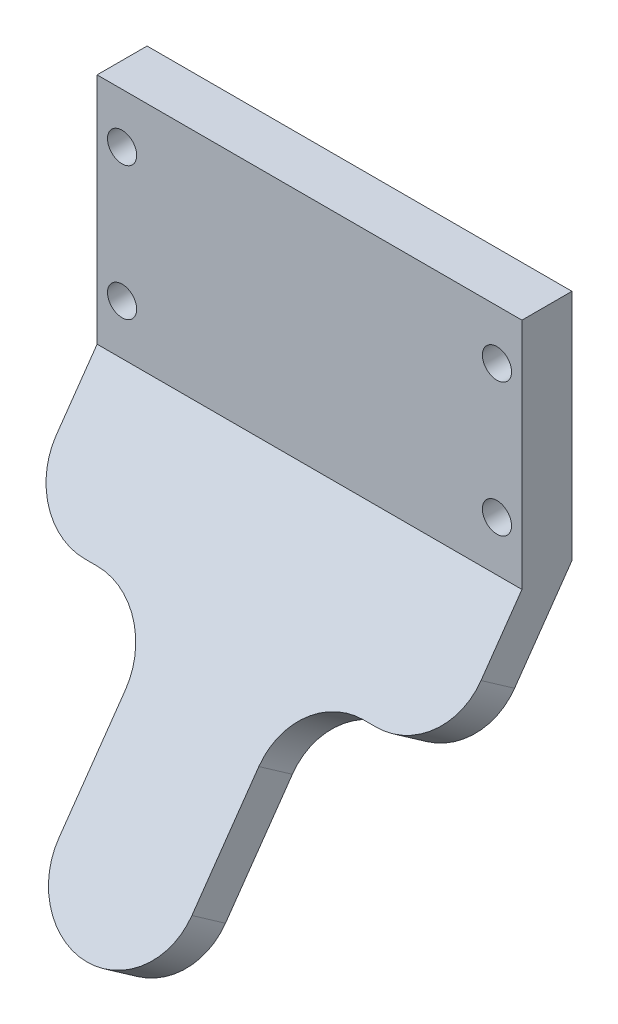
from build123d import *

# Parameters (mm, degrees)
ESQUISSE1_W             = 51
ESQUISSE1_H             = 28
BOSS_EXTRU_1_DEPTH      = 6
ESQUISSE2_R             = 1.75
ENL_V_MAT_EXTRU_1_DEPTH = 59.489315264
BOSS_EXTRU_2_DEPTH      = 51
ESQUISSE4_W             = 17.5
ESQUISSE4_H             = 30
ENL_V_MAT_EXTRU_2_DEPTH = 4.914913
CONG_1_R                = 8


with BuildPart() as part:
    # Esquisse1 → Boss.-Extru.1 (new body)
    with BuildSketch(Plane.XY):
        with Locations((25.5, 14)):
            Rectangle(ESQUISSE1_W, ESQUISSE1_H)
    extrude(amount=BOSS_EXTRU_1_DEPTH)

    # Esquisse2 → Enlèv. mat.-Extru.1 (cut, through all)
    with BuildSketch(Plane.XY.offset(6)):
        with Locations((3, 6)):
            Circle(ESQUISSE2_R)
        with Locations((3, 22)):
            Circle(ESQUISSE2_R)
        with Locations(Location((48, 22, 0), (0, 0, 180))):
            Circle(ESQUISSE2_R)
        with Locations(Location((48, 6, 0), (0, 0, 180))):
            Circle(ESQUISSE2_R)
    extrude(amount=-ENL_V_MAT_EXTRU_1_DEPTH, mode=Mode.SUBTRACT)

    # Esquisse3 → Boss.-Extru.2 (add)
    with BuildSketch(Plane.ZY):
        Polygon((0, 0), (28.678821818, -40.957602214), (32.704882248, -38.138524352), (6, 0), align=None)
    extrude(amount=-BOSS_EXTRU_2_DEPTH)

    # Esquisse4 → Enlèv. mat.-Extru.2 (cut)
    with BuildSketch(Plane(origin=(0, 0, 0), x_dir=(-1, 0, 0), z_dir=(0, -0.5735764363510419, -0.8191520442889949))):
        with Locations((-8.75, -35)):
            Rectangle(ESQUISSE4_W, ESQUISSE4_H)
        with Locations((-42.25, -35)):
            Rectangle(ESQUISSE4_W, ESQUISSE4_H)
    extrude(amount=-ENL_V_MAT_EXTRU_2_DEPTH, mode=Mode.SUBTRACT)

    # Congé1
    cong_1_edges = [part.edges().sort_by_distance(p)[0] for p in [
        (33.5, -14.973501955, 13.484558942),
        (17.5, -14.973501955, 13.484558942),
        (33.5, -39.548063283, 30.691852033),
        (17.5, -39.548063283, 30.691852033),
        (0, -14.973501955, 13.484558942),
        (51, -14.973501955, 13.484558942),
    ]]
    fillet(cong_1_edges, radius=CONG_1_R - 0.0001)  # a hair under: the kernel refuses the full size


solid = part.part
